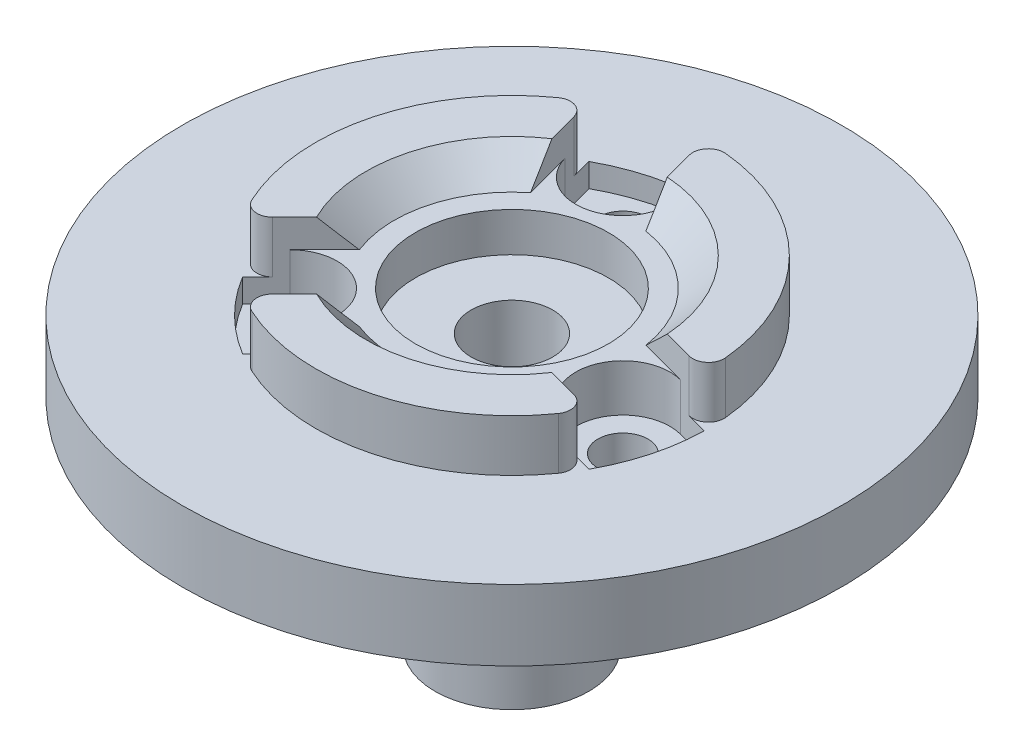
from build123d import *
from build123d.topology import SkipClean

# Parameters (mm, degrees)
SKETCH_1_R               = 4
SKETCH_1_R_2             = 2.625
EXTRUDE_1_DEPTH          = 6
SKETCH_2_R               = 12.5
SKETCH_2_R_2             = 2.6
EXTRUDE_2_DEPTH          = 6
SKETCH_3_R               = 1.6
CUT_EXTRUDE_1_DEPTH      = 15
SKETCH_6_R               = 1.6
CUT_EXTRUDE_5_DEPTH      = 3
PATTERN_CIRCULAR_1_COUNT = 3
EXTRUDE_START            = 13.8
SKETCH_4_R               = 4.9
SKETCH_4_R_2             = 2.6
EXTRUDE_3_DEPTH          = 13.8
SKETCH_7_R               = 6.15
CUT_EXTRUDE_7_DEPTH      = 2.5
CUT_EXTRUDE_8_DEPTH      = 12.55
SKETCH_10_R              = 21
SKETCH_10_R_2            = 12.5
EXTRUDE_4_DEPTH          = 4.5
EXTRUDE_5_DEPTH          = 1.8
PATTERN_CIRCULAR_2_COUNT = 3
FILLET_1_R               = 1
CHAMFER_1_SIZE           = 0.5
CHAMFER_2_SIZE           = 2


with BuildPart() as part:
    # 草图1 → 凸台-拉伸1 (new body)
    with BuildSketch(Plane(origin=(0, 0, 0), x_dir=(1, 0, 0), z_dir=(0, 1, 0))):
        with Locations(Location((0, 0, 0), (0, 0, 270))):
            Circle(SKETCH_1_R)
        with Locations(Location((0, 0, 0), (0, 0, 270))):
            Circle(SKETCH_1_R_2, mode=Mode.SUBTRACT)
    extrude(amount=EXTRUDE_1_DEPTH)

    # 草图2 → 凸台-拉伸2 (add)
    with BuildSketch(Plane(origin=(0, 0, 0), x_dir=(-1, 0, 0), z_dir=(0, -1, 0))):
        with Locations(Location((0, 0, 0), (0, 0, 90))):
            Circle(SKETCH_2_R)
        with Locations(Location((0, 0, 0), (0, 0, 90))):
            Circle(SKETCH_2_R_2, mode=Mode.SUBTRACT)
    extrude(amount=-EXTRUDE_2_DEPTH)

    # 草图3 → 切除-拉伸1 (cut)
    with BuildSketch(Plane(origin=(0, 6, 0), x_dir=(1, 0, 0), z_dir=(0, 1, 0))):
        with Locations(Location((-2.588190451, 9.659258263, 0), (0, 0, 270))):
            Circle(SKETCH_3_R)
    cut_extrude_1 = extrude(amount=-CUT_EXTRUDE_1_DEPTH, mode=Mode.SUBTRACT)

    # 草图6 → 切除-拉伸5 (cut)
    with BuildSketch(Plane(origin=(0, 6, 0), x_dir=(1, 0, 0), z_dir=(0, 1, 0))):
        with BuildLine():
            Line((-6.038458877, 10.944725414), (-5.48596793, 8.882801128))
            ThreePointArc((-5.48596793, 8.882801128), (-1.811733316, 6.761480784), (0.309587028, 10.435715398))
            Line((0.309587028, 10.435715398), (-0.24290392, 12.497639685))
            ThreePointArc((-0.24290392, 12.497639685), (-3.235238064, 12.074072829), (-6.038458877, 10.944725414))
        make_face()
        with Locations(Location((-2.588190451, 9.659258263, 0), (0, 0, 270))):
            Circle(SKETCH_6_R, mode=Mode.SUBTRACT)
    cut_extrude_5 = extrude(amount=-CUT_EXTRUDE_5_DEPTH, mode=Mode.SUBTRACT)

    # 阵列(圆周)1: 切除-拉伸1, 切除-拉伸5 ×3 about axis
    pattern_circular_1_axis = Axis((0, 0, 0), (0, 1, 0))
    add([cut_extrude_1.rotate(pattern_circular_1_axis, i * 360 / PATTERN_CIRCULAR_1_COUNT) for i in range(1, PATTERN_CIRCULAR_1_COUNT)], mode=Mode.SUBTRACT)
    add([cut_extrude_5.rotate(pattern_circular_1_axis, i * 360 / PATTERN_CIRCULAR_1_COUNT) for i in range(1, PATTERN_CIRCULAR_1_COUNT)], mode=Mode.SUBTRACT)

    # 草图4 → 凸台-拉伸3 (add)
    with BuildSketch(Plane(origin=(0, 0, 0), x_dir=(-1, 0, 0), z_dir=(0, -1, 0)).offset(EXTRUDE_START)):
        with Locations(Location((0, 0, 0), (0, 0, 270))):
            Circle(SKETCH_4_R)
        with Locations(Location((0, 0, 0), (0, 0, 90))):
            Circle(SKETCH_4_R_2, mode=Mode.SUBTRACT)
    extrude(amount=-EXTRUDE_3_DEPTH)

    # 草图7 → 切除-拉伸7 (cut)
    with BuildSketch(Plane(origin=(0, 6, 0), x_dir=(1, 0, 0), z_dir=(0, 1, 0))):
        with Locations(Location((0, 0, 0), (0, 0, 270))):
            Circle(SKETCH_7_R)
    extrude(amount=-CUT_EXTRUDE_7_DEPTH, mode=Mode.SUBTRACT)

    # 草图8 → 切除-拉伸8 (cut)
    with BuildSketch(Plane(origin=(0, -13.8, 0), x_dir=(-1, 0, 0), z_dir=(0, -1, 0))):
        Polygon((-2.57196423, -2.57196423), (0.941404246, -3.513368476), (3.513368476, -0.941404246), (2.57196423, 2.57196423), (-0.941404246, 3.513368476), (-3.513368476, 0.941404246), align=None)
    extrude(amount=-CUT_EXTRUDE_8_DEPTH, mode=Mode.SUBTRACT)

    # 草图10 → 凸台-拉伸4 (add)
    with BuildSketch(Plane(origin=(0, 0, 0), x_dir=(1, 0, 0), z_dir=(0, 1, 0))):
        with Locations(Location((0, 0, 0), (0, 0, 270))):
            Circle(SKETCH_10_R)
        Circle(SKETCH_10_R_2, mode=Mode.SUBTRACT)
    extrude(amount=EXTRUDE_4_DEPTH)

    # 草图11 → 凸台-拉伸5 (add)
    with BuildSketch(Plane(origin=(0, 6, 0), x_dir=(1, 0, 0), z_dir=(0, 1, 0))):
        with BuildLine():
            Line((-5.230740824, 7.930280602), (-6.038458877, 10.944725414))
            ThreePointArc((-6.038458877, 10.944725414), (-12.074072829, 3.235238064), (-10.701821494, -6.459180807))
            Line((-10.701821494, -6.459180807), (-8.495094736, -4.252454048))
            ThreePointArc((-8.495094736, -4.252454048), (-9.17629535, 2.458780928), (-5.230740824, 7.930280602))
        make_face()
    extrude_5 = extrude(amount=EXTRUDE_5_DEPTH)

    # 阵列(圆周)2: 凸台-拉伸5 ×3 about axis
    with SkipClean():  # the faces are left unmerged after this step: merging them gives an invalid solid
        pattern_circular_2_axis = Axis((0, 3.5, 0), (0, 1, 0))
        for i in range(1, PATTERN_CIRCULAR_2_COUNT):
            add(extrude_5.rotate(pattern_circular_2_axis, i * 360 / PATTERN_CIRCULAR_2_COUNT))

    # 圆角1
    fillet_1_edges = [part.edges().sort_by_distance(p)[0] for p in [
        (-10.701821494, 6.9, 6.459180807),
        (-6.459180807, 6.9, 10.701821494),
        (10.944725414, 6.9, 6.038458877),
        (12.497639685, 6.9, 0.24290392),
        (-0.24290392, 6.9, -12.497639685),
        (-6.038458877, 6.9, -10.944725414),
    ]]
    fillet(fillet_1_edges, radius=FILLET_1_R)

    # 倒角1
    chamfer_1_edges = [part.edges().sort_by_distance(p)[0] for p in [
        (0, 0, -4.9),
    ]]
    chamfer(chamfer_1_edges, length=CHAMFER_1_SIZE)

    # 倒角2
    # the kernel refuses this chamfer: 2 mm, written as the material it adds along each edge
    with BuildSketch(Plane(origin=(0, 6, 0), x_dir=(-0.46364396793112084, 0, -0.8860215973671781), z_dir=(-0.8860215973671781, 0, 0.46364396793112084))) as chamfer_2_piece_1_section:
        Polygon((9.5 - CHAMFER_2_SIZE, 0), (9.5, -CHAMFER_2_SIZE), (9.5, 0), align=None)
    chamfer_2_piece_1 = revolve(axis=Axis((0, 6, 0), (0, -1, 0)), revolution_arc=145.244994466, mode=Mode.PRIVATE)
    chamfer_2_piece_1 = split(chamfer_2_piece_1, bisect_by=Plane(origin=(4.843261848, 6.879467901, -1.80808044), z_dir=(0.2588190451025276, 0, -0.9659258262890666)), keep=Keep.TOP, mode=Mode.PRIVATE)
    chamfer_2_piece_1 = split(chamfer_2_piece_1, bisect_by=Plane(origin=(1.80808044, 6.879467901, -4.843261848), z_dir=(0.9659258262890712, 0, -0.2588190451025102)), keep=Keep.TOP, mode=Mode.PRIVATE)
    chamfer_2_piece_1 = split(chamfer_2_piece_1, bisect_by=Plane(origin=(5.954215348, 7.8, -5.954215348), z_dir=(0, -1, 0)), keep=Keep.TOP, mode=Mode.PRIVATE)
    add(chamfer_2_piece_1)
    with BuildSketch(Plane(origin=(0, 6, 0), x_dir=(0.9991391955872041, 0, 0.04148334414382066), z_dir=(0.04148334414382066, 0, -0.9991391955872041))) as chamfer_2_piece_2_section:
        Polygon((9.5 - CHAMFER_2_SIZE, 0), (9.5, -CHAMFER_2_SIZE), (9.5, 0), align=None)
    chamfer_2_piece_2 = revolve(axis=Axis((0, 6, 0), (0, -1, 0)), revolution_arc=145.244994466, mode=Mode.PRIVATE)
    chamfer_2_piece_2 = split(chamfer_2_piece_2, bisect_by=Plane(origin=(3.290347577, 6.879467901, 3.987474517), z_dir=(-0.25881904510253106, 0, 0.9659258262890655)), keep=Keep.TOP, mode=Mode.PRIVATE)
    chamfer_2_piece_2 = split(chamfer_2_piece_2, bisect_by=Plane(origin=(-0.855787331, 6.879467901, 5.098428018), z_dir=(0.7071067811865428, 0, 0.7071067811865523)), keep=Keep.TOP, mode=Mode.PRIVATE)
    chamfer_2_piece_2 = split(chamfer_2_piece_2, bisect_by=Plane(origin=(2.179394077, 7.8, 8.133609425), z_dir=(0, -1, 0)), keep=Keep.TOP, mode=Mode.PRIVATE)
    add(chamfer_2_piece_2)
    with BuildSketch(Plane(origin=(0, 6, 0), x_dir=(-0.535495227656083, 0, 0.8445382532233574), z_dir=(0.8445382532233574, 0, 0.535495227656083))) as chamfer_2_piece_3_section:
        Polygon((9.5, -CHAMFER_2_SIZE), (9.5 - CHAMFER_2_SIZE, 0), (9.5, 0), align=None)
    chamfer_2_piece_3 = revolve(axis=Axis((0, 6, 0), (0, -1, 0)), revolution_arc=145.244994466, mode=Mode.PRIVATE)
    chamfer_2_piece_3 = split(chamfer_2_piece_3, bisect_by=Plane(origin=(-3.987474517, 6.879467901, -3.290347577), z_dir=(-0.96592582628907, 0, 0.25881904510251447)), keep=Keep.TOP, mode=Mode.PRIVATE)
    chamfer_2_piece_3 = split(chamfer_2_piece_3, bisect_by=Plane(origin=(-5.098428018, 6.879467901, 0.855787331), z_dir=(-0.7071067811865401, 0, -0.7071067811865549)), keep=Keep.TOP, mode=Mode.PRIVATE)
    chamfer_2_piece_3 = split(chamfer_2_piece_3, bisect_by=Plane(origin=(-8.133609425, 7.8, -2.179394077), z_dir=(0, -1, 0)), keep=Keep.TOP, mode=Mode.PRIVATE)
    add(chamfer_2_piece_3)


solid = part.part
